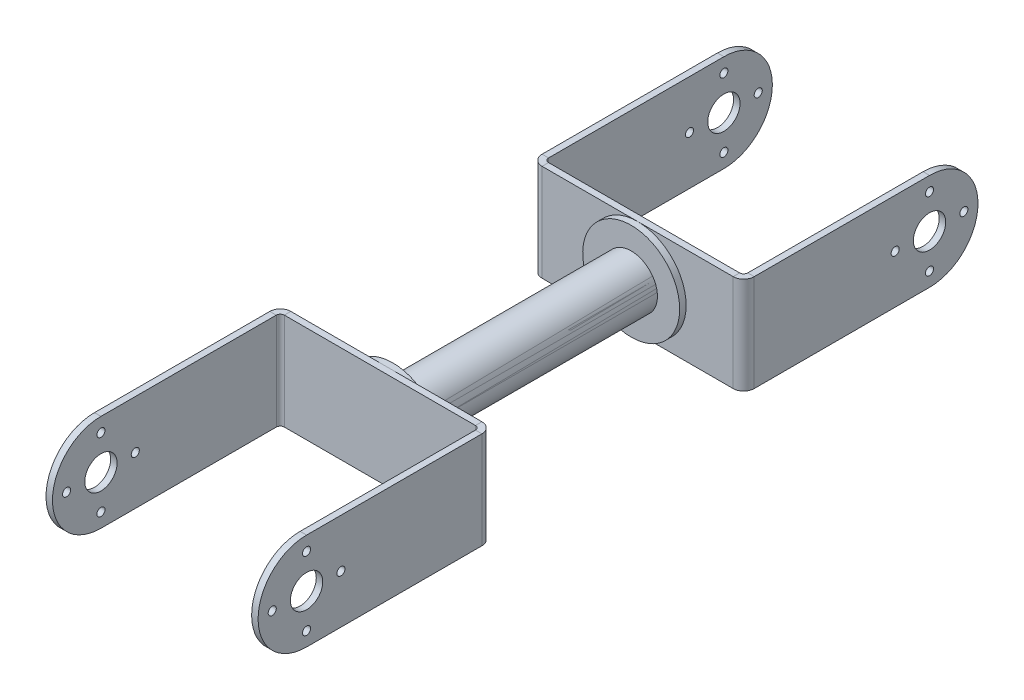
from build123d import *

# Parameters (mm, degrees)
BASE_FLANGE1_DEPTH      = 24
CUT_EXTRUDE1_DEPTH      = 69.037214082
CUT_EXTRUDE1_DEPTH_BACK = 69.037214082
SKETCH5_R               = 1
SKETCH5_R_2             = 4
SKETCH6_R               = 12
BOSS_EXTRUDE1_DEPTH     = 1.6
SKETCH7_R               = 6.5
BOSS_EXTRUDE2_DEPTH     = 59


# Sheet-metal steps are written as plain solids
with BuildPart() as part:
    # Sketch1 → Base-Flange1 (new body)
    with BuildSketch(Plane(origin=(0, 0, 0), x_dir=(1, 0, 0), z_dir=(0, 1, 0))):
        with BuildLine():
            Line((-26.25, 58), (-26.25, 2.6))
            ThreePointArc((-26.25, 2.6), (-25.488477631, 0.761522369), (-23.65, 0))
            Line((-23.65, 0), (23.65, 0))
            ThreePointArc((23.65, 0), (25.488477631, 0.761522369), (26.25, 2.6))
            Line((26.25, 2.6), (26.25, 58))
            Line((26.25, 58), (24.65, 58))
            Line((24.65, 58), (24.65, 2.6))
            ThreePointArc((24.65, 2.6), (24.357106781, 1.892893219), (23.65, 1.6))
            Line((23.65, 1.6), (-23.65, 1.6))
            ThreePointArc((-23.65, 1.6), (-24.357106781, 1.892893219), (-24.65, 2.6))
            Line((-24.65, 2.6), (-24.65, 58))
            Line((-24.65, 58), (-26.25, 58))
        make_face()
    extrude(amount=BASE_FLANGE1_DEPTH)

    # Sketch5 → Cut-Extrude1 (cut, two sides: drawn at the far end of the back side and taken through both)
    with BuildSketch(Plane(origin=(0, 0, 0), x_dir=(0, 0, -1), z_dir=(1, 0, 0)).offset(-CUT_EXTRUDE1_DEPTH_BACK)):
        with BuildLine():
            Line((58, 12), (58, 24))
            Line((58, 24), (46, 24))
            ThreePointArc((46, 24), (54.485281374, 20.485281374), (58, 12))
        make_face()
        with BuildLine():
            Line((58, 0), (58, 12))
            ThreePointArc((58, 12), (54.485281374, 3.514718626), (46, 0))
            Line((46, 0), (58, 0))
        make_face()
        with Locations(Location((37.5, 12, 0), (0, 0, 180))):
            Circle(SKETCH5_R)
        with Locations(Location((46, 3.5, 0), (0, 0, 180))):
            Circle(SKETCH5_R)
        with Locations(Location((54.5, 12, 0), (0, 0, 180))):
            Circle(SKETCH5_R)
        with Locations(Location((46, 20.5, 0), (0, 0, 180))):
            Circle(SKETCH5_R)
        with Locations(Location((46, 12, 0), (0, 0, 180))):
            Circle(SKETCH5_R_2)
    extrude(amount=CUT_EXTRUDE1_DEPTH + CUT_EXTRUDE1_DEPTH_BACK, mode=Mode.SUBTRACT)

    # Sketch6 → Boss-Extrude1 (add)
    with BuildSketch(Plane.XY):
        with Locations(Location((0, 12, 0), (0, 0, 270))):
            Circle(SKETCH6_R)
    extrude(amount=BOSS_EXTRUDE1_DEPTH)

    # Sketch7 → Boss-Extrude2 (add)
    with BuildSketch(Plane.XY.offset(1.6)):
        with Locations((0, 12)):
            Circle(SKETCH7_R)
    extrude(amount=BOSS_EXTRUDE2_DEPTH)


with BuildPart() as body_2:
    # Mirror1: mirrored copy
    add(part.part.mirror(Plane.XY.offset(31.1)))


solid = Compound([part.part, body_2.part])
